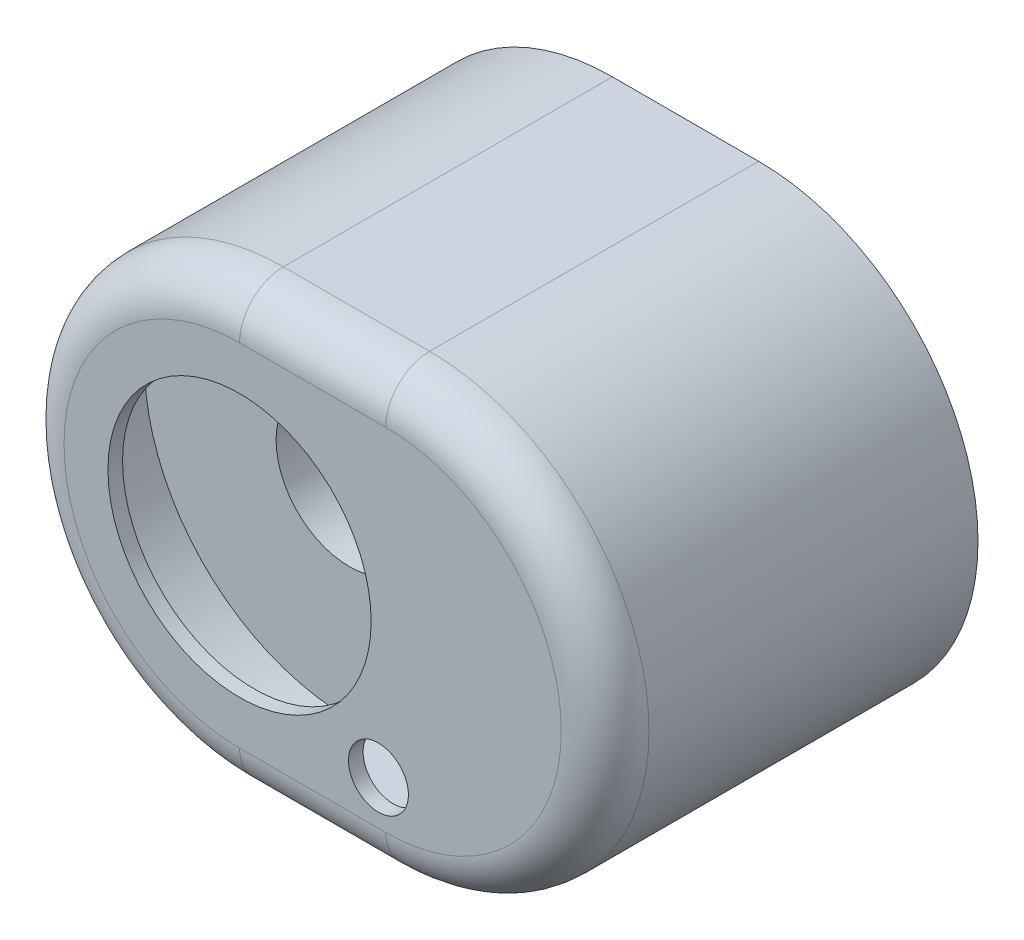
from build123d import *

# Parameters (mm, degrees)
EXTRUDE_1_DEPTH     = 51
FILLET_1_R          = 6
SHELL_1_T           = -2
SKETCH_3_R          = 18
CUT_EXTRUDE_1_DEPTH = 72.421285343
SKETCH_5_R          = 4.1
CUT_EXTRUDE_2_DEPTH = 4
EXTRUDE_START       = -2
EXTRUDE_2_DEPTH     = 6
EXTRUDE_START_2     = -3
EXTRUDE_3_DEPTH     = 3
EXTRUDE_32_REACH    = 62.465
EXTRUDE_36_REACH    = 62.465
EXTRUDE_37_REACH    = 62.465
SKETCH_14_W         = 19.811684382
SKETCH_14_H         = 2
EXTRUDE_4_DEPTH     = 24.8
HOLE_WIZARD_1_D     = 2
HOLE_WIZARD_1_DEPTH = 10
SKETCH_24_R         = 3
EXTRUDE_5_DEPTH     = 6
FILLET_2_R          = 3
HOLE_WIZARD_2_D     = 2.1
HOLE_WIZARD_2_DEPTH = 10


# Read off the part's stored shape, not the designer's step: 凸台-拉伸4
with BuildPart() as part:
    # 草图2 → 凸台-拉伸1 (new body)
    with BuildSketch(Plane.XY):
        with BuildLine():
            Line((-10, 30), (10, 30))
            ThreePointArc((10, 30), (40, 0), (10, -30))
            Line((10, -30), (-10, -30))
            ThreePointArc((-10, -30), (-40, 0), (-10, 30))
        make_face()
    extrude(amount=EXTRUDE_1_DEPTH)

    # 圆角1
    fillet_1_edges = [part.edges().sort_by_distance(p)[0] for p in [
        (40, 0, 51),
        (0, 30, 51),
        (-40, 0, 51),
        (0, -30, 51),
    ]]
    fillet(fillet_1_edges, radius=FILLET_1_R)

    # 抽壳1
    shell_1_openings = [part.faces().sort_by_distance(p)[0] for p in [
        (0, 0, 0),
    ]]
    offset(amount=SHELL_1_T, openings=shell_1_openings, kind=Kind.INTERSECTION)

    # 草图3 → 切除-拉伸1 (cut, through all)
    with BuildSketch(Plane.XY.offset(51)):
        with Locations((-10, 0)):
            Circle(SKETCH_3_R)
    extrude(amount=-CUT_EXTRUDE_1_DEPTH, mode=Mode.SUBTRACT)

    # 草图5 → 切除-拉伸2 (cut)
    with BuildSketch(Plane.XY.offset(51)):
        with Locations((9, -18)):
            Circle(SKETCH_5_R)
    extrude(amount=-CUT_EXTRUDE_2_DEPTH, mode=Mode.SUBTRACT)

    # 草图6 → 凸台-拉伸2 (add)
    with BuildSketch(Plane(origin=(0, 0, 0), x_dir=(-1, 0, 0), z_dir=(0, 0, -1)).offset(EXTRUDE_START)):
        with BuildLine():
            Line((10, 28), (-10, 28))
            ThreePointArc((-10, 28), (-38, 0), (-10, -28))
            Line((-10, -28), (10, -28))
            ThreePointArc((10, -28), (38, 0), (10, 28))
        make_face()
        with BuildLine():
            Line((10, 26.5), (-10, 26.5))
            ThreePointArc((-10, 26.5), (-36.5, 0), (-10, -26.5))
            Line((-10, -26.5), (10, -26.5))
            ThreePointArc((10, -26.5), (36.5, 0), (10, 26.5))
        make_face(mode=Mode.SUBTRACT)
    extrude(amount=-EXTRUDE_2_DEPTH)



with BuildPart() as body_2:
    # 草图4 → 旋转1 (revolve)
    with BuildSketch(Plane(origin=(0, 0, 0), x_dir=(1, 0, 0), z_dir=(0, 1, 0))):
        Polygon((-20, -36), (-20, -30), (-18, -30), (-18, -28), (-14.5, -23), (-14.5, -21), (-16.5, -21), (-16.5, -17), (-19.5, -17), (-19.5, -23.167682505), (-23, -28.167682505), (-23, -36), align=None)
    revolve(axis=Axis((-10, 0, 0), (0, 0, 1)))


with BuildPart() as part_1:
    add(part.part)

    add(body_2.part)  # 凸台-拉伸3 merges body 2
    # 草图7 → 凸台-拉伸3 (add)
    with BuildSketch(Plane.XY.offset(36).offset(EXTRUDE_START_2)):
        with BuildLine():
            Line((-3, 7.141428429), (-3, 28))
            Line((-3, 28), (-10, 28))
            ThreePointArc((-10, 28), (-38, 0), (-10, -28))
            Line((-10, -28), (-3, -28))
            Line((-3, -28), (-3, -7.141428429))
            ThreePointArc((-3, -7.141428429), (-20, 0), (-3, 7.141428429))
        make_face()
    extrude(amount=EXTRUDE_3_DEPTH)

    # 草图12 → 拉伸-薄壁32 (add, up to next)
    with BuildSketch(Plane(origin=(0, 0, 17), x_dir=(-1, 0, 0), z_dir=(0, 0, -1)), mode=Mode.PRIVATE) as extrude_32_sk1:
        Polygon((3, -28), (3, -10.95445115), (6.5, -5.477225575), (8.185300177, -6.554148652), (5, -11.538893679), (5, -28), align=None)
    extrude_32_tool1 = extrude(extrude_32_sk1.sketch, amount=-EXTRUDE_32_REACH, mode=Mode.PRIVATE) - part_1.part
    add(extrude_32_tool1.solids().sort_by_distance((-4.44371, -16.649108, 17))[0])

    # 草图12<6> → 拉伸-薄壁36 (add, up to next)
    with BuildSketch(Plane(origin=(0, 0, 17), x_dir=(-1, 0, 0), z_dir=(0, 0, -1)), mode=Mode.PRIVATE) as extrude_36_sk1:
        Polygon((3, 26.5), (3, 10.95445115), (6.5, 5.477225575), (8.185300177, 6.554148652), (5, 11.538893679), (5, 26.5), align=None)
    extrude_36_tool1 = extrude(extrude_36_sk1.sketch, amount=-EXTRUDE_36_REACH, mode=Mode.PRIVATE) - part_1.part
    add(extrude_36_tool1.solids().sort_by_distance((-4.474722, 15.908171, 17))[0])

    # 草图14 → 拉伸-薄壁37 (add, up to next)
    with BuildSketch(Plane(origin=(0, 0, 17), x_dir=(-1, 0, 0), z_dir=(0, 0, -1)), mode=Mode.PRIVATE) as extrude_37_sk1:
        with Locations((28.094157809, 0)):
            Rectangle(SKETCH_14_W, SKETCH_14_H)
    extrude_37_tool1 = extrude(extrude_37_sk1.sketch, amount=-EXTRUDE_37_REACH, mode=Mode.PRIVATE) - part_1.part
    # 草图14 → 拉伸-薄壁37 (add, up to next)
    with BuildSketch(Plane(origin=(0, 0, 17), x_dir=(-1, 0, 0), z_dir=(0, 0, -1)), mode=Mode.PRIVATE) as extrude_37_sk2:
        Polygon((16.029392267, 5.629826068), (28.764097514, 20.806456798), (27.232008628, 22.092032017), (14.49730338, 6.915401287), align=None)
    extrude_37_tool2 = extrude(extrude_37_sk2.sketch, amount=-EXTRUDE_37_REACH, mode=Mode.PRIVATE) - part_1.part
    # 草图14 → 拉伸-薄壁37 (add, up to next)
    with BuildSketch(Plane(origin=(0, 0, 17), x_dir=(-1, 0, 0), z_dir=(0, 0, -1)), mode=Mode.PRIVATE) as extrude_37_sk3:
        Polygon((14.49730338, -6.915401287), (27.232008628, -22.092032017), (28.764097514, -20.806456798), (16.029392267, -5.629826068), align=None)
    extrude_37_tool3 = extrude(extrude_37_sk3.sketch, amount=-EXTRUDE_37_REACH, mode=Mode.PRIVATE) - part_1.part
    add(extrude_37_tool1.solids().sort_by_distance((-28.094158, 0, 17))[0])
    add(extrude_37_tool2.solids().sort_by_distance((-21.6307, 13.860929, 17))[0])
    add(extrude_37_tool3.solids().sort_by_distance((-21.6307, -13.860929, 17))[0])

    # 凸台-拉伸4 outline → 凸台-拉伸4 (add)
    with BuildSketch(Plane.XY.offset(24.2)):
        with BuildLine():
            ThreePointArc((16.890769815, -27.138852064), (21.143513187, -25.687002819), (25.109230185, -23.573526745))
            Line((25.109230185, -23.573526745), (25.109230185, -19.500000001))
            ThreePointArc((25.109230185, -19.500000001), (21.000000001, -15.390769815), (16.890769815, -19.5))
            Line((16.890769815, -19.5), (16.890769815, -27.138852064))
        make_face()
        with BuildLine():
            ThreePointArc((16.890769815, 19.5), (21.000000001, 15.390769815), (25.109230185, 19.500000001))
            Line((25.109230185, 19.500000001), (25.109230185, 23.573526745))
            ThreePointArc((25.109230185, 23.573526745), (21.143513187, 25.687002819), (16.890769815, 27.138852064))
            Line((16.890769815, 27.138852064), (16.890769815, 19.5))
        make_face()
    extrude(amount=EXTRUDE_4_DEPTH)

    # 孔1
    with Locations(Plane(origin=(0, 0, 24.2), x_dir=(-1, 0, 0), z_dir=(0, 0, -1))):
        with Locations((-21, 19.5), (-21, -19.5)):
            Hole(HOLE_WIZARD_1_D / 2, depth=HOLE_WIZARD_1_DEPTH)

    # 草图24 → 凸台-拉伸5 (add)
    with BuildSketch(Plane(origin=(0, 0, 2), x_dir=(-1, 0, 0), z_dir=(0, 0, -1))):
        with Locations((-29, 16)):
            Circle(SKETCH_24_R)
        with Locations((-29, -16)):
            Circle(SKETCH_24_R)
        with Locations((29, -16)):
            Circle(SKETCH_24_R)
        with Locations((29, 16)):
            Circle(SKETCH_24_R)
    extrude(amount=-EXTRUDE_5_DEPTH)

    # 圆角2
    fillet_2_edges = [part_1.edges().sort_by_distance(p)[0] for p in [
        (28.513678356, 18.960319452, 5),
        (31.834376749, 15.01699011, 5),
        (28.513678356, -18.960319452, 5),
        (31.834376749, -15.01699011, 5),
        (-28.513678356, -18.960319452, 5),
        (-31.834376749, -15.01699011, 5),
        (-28.513678356, 18.960319452, 5),
        (-31.834376749, 15.01699011, 5),
    ]]
    fillet(fillet_2_edges, radius=FILLET_2_R)

    # 孔2
    with Locations(Plane(origin=(0, 0, 2), x_dir=(-1, 0, 0), z_dir=(0, 0, -1))):
        with Locations((-29, 16), (-29, -16), (29, 16), (29, -16)):
            Hole(HOLE_WIZARD_2_D / 2, depth=HOLE_WIZARD_2_DEPTH)


solid = part_1.part
